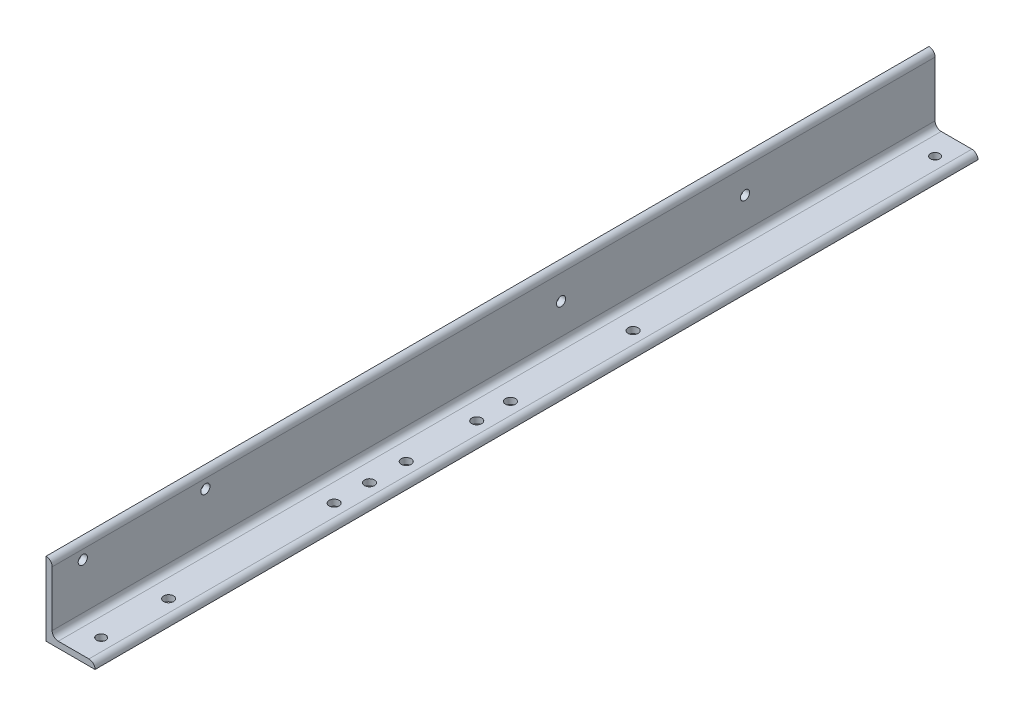
from build123d import *

# Parameters (mm, degrees)
BOSS_EXTRUDE1_DEPTH = 914.4
CUT_EXTRUDE2_REACH  = 932.573
SKETCH3_R           = 9.525
SKETCH3_R_2         = 10.31875
CUT_EXTRUDE3_REACH  = 933.266
SKETCH4_R           = 9.525


with BuildPart() as part:
    # Sketch1 → Boss-Extrude1 (new, symmetric)
    with BuildSketch(Plane.XY):
        with BuildLine():
            Line((0, 0), (0, 152.4))
            Line((0, 152.4), (0.00508, 152.4))
            ThreePointArc((0.00508, 152.4), (8.981744019, 148.681744019), (12.7, 139.70508))
            Line((12.7, 139.70508), (12.7, 25.4))
            ThreePointArc((12.7, 25.4), (16.419743879, 16.419743879), (25.4, 12.7))
            Line((25.4, 12.7), (88.90508, 12.7))
            ThreePointArc((88.90508, 12.7), (97.881744019, 8.981744019), (101.6, 0.00508))
            Line((101.6, 0.00508), (101.6, 0))
            Line((101.6, 0), (0, 0))
        make_face()
    extrude(amount=BOSS_EXTRUDE1_DEPTH, both=True)

    # Sketch3 → Cut-Extrude2 (cut, up to next)
    with BuildSketch(Plane(origin=(0, 12.7, 0), x_dir=(1, 0, 0), z_dir=(0, 1, 0)), mode=Mode.PRIVATE) as cut_extrude2_sk1:
        with Locations((63.5, -863.6)):
            Circle(SKETCH3_R)
    cut_extrude2_tool1 = extrude(cut_extrude2_sk1.sketch, amount=-CUT_EXTRUDE2_REACH, mode=Mode.PRIVATE) & part.part
    # Sketch3 → Cut-Extrude2 (cut, up to next)
    with BuildSketch(Plane(origin=(0, 12.7, 0), x_dir=(1, 0, 0), z_dir=(0, 1, 0)), mode=Mode.PRIVATE) as cut_extrude2_sk2:
        with Locations((63.5, 863.6)):
            Circle(SKETCH3_R)
    cut_extrude2_tool2 = extrude(cut_extrude2_sk2.sketch, amount=-CUT_EXTRUDE2_REACH, mode=Mode.PRIVATE) & part.part
    # Sketch3 → Cut-Extrude2 (cut, up to next)
    with BuildSketch(Plane(origin=(0, 12.7, 0), x_dir=(1, 0, 0), z_dir=(0, 1, 0)), mode=Mode.PRIVATE) as cut_extrude2_sk3:
        with Locations((63.5, -723.9)):
            Circle(SKETCH3_R_2)
    cut_extrude2_tool3 = extrude(cut_extrude2_sk3.sketch, amount=-CUT_EXTRUDE2_REACH, mode=Mode.PRIVATE) & part.part
    # Sketch3 → Cut-Extrude2 (cut, up to next)
    with BuildSketch(Plane(origin=(0, 12.7, 0), x_dir=(1, 0, 0), z_dir=(0, 1, 0)), mode=Mode.PRIVATE) as cut_extrude2_sk4:
        with Locations((63.5, -381)):
            Circle(SKETCH3_R_2)
    cut_extrude2_tool4 = extrude(cut_extrude2_sk4.sketch, amount=-CUT_EXTRUDE2_REACH, mode=Mode.PRIVATE) & part.part
    # Sketch3 → Cut-Extrude2 (cut, up to next)
    with BuildSketch(Plane(origin=(0, 12.7, 0), x_dir=(1, 0, 0), z_dir=(0, 1, 0)), mode=Mode.PRIVATE) as cut_extrude2_sk5:
        with Locations((63.5, -15.875)):
            Circle(SKETCH3_R_2)
    cut_extrude2_tool5 = extrude(cut_extrude2_sk5.sketch, amount=-CUT_EXTRUDE2_REACH, mode=Mode.PRIVATE) & part.part
    # Sketch3 → Cut-Extrude2 (cut, up to next)
    with BuildSketch(Plane(origin=(0, 12.7, 0), x_dir=(1, 0, 0), z_dir=(0, 1, 0)), mode=Mode.PRIVATE) as cut_extrude2_sk6:
        with Locations((63.5, -231.775)):
            Circle(SKETCH3_R_2)
    cut_extrude2_tool6 = extrude(cut_extrude2_sk6.sketch, amount=-CUT_EXTRUDE2_REACH, mode=Mode.PRIVATE) & part.part
    # Sketch3 → Cut-Extrude2 (cut, up to next)
    with BuildSketch(Plane(origin=(0, 12.7, 0), x_dir=(1, 0, 0), z_dir=(0, 1, 0)), mode=Mode.PRIVATE) as cut_extrude2_sk7:
        with Locations((63.5, 238.125)):
            Circle(SKETCH3_R_2)
    cut_extrude2_tool7 = extrude(cut_extrude2_sk7.sketch, amount=-CUT_EXTRUDE2_REACH, mode=Mode.PRIVATE) & part.part
    # Sketch3 → Cut-Extrude2 (cut, up to next)
    with BuildSketch(Plane(origin=(0, 12.7, 0), x_dir=(1, 0, 0), z_dir=(0, 1, 0)), mode=Mode.PRIVATE) as cut_extrude2_sk8:
        with Locations((63.5, -307.975)):
            Circle(SKETCH3_R_2)
    cut_extrude2_tool8 = extrude(cut_extrude2_sk8.sketch, amount=-CUT_EXTRUDE2_REACH, mode=Mode.PRIVATE) & part.part
    # Sketch3 → Cut-Extrude2 (cut, up to next)
    with BuildSketch(Plane(origin=(0, 12.7, 0), x_dir=(1, 0, 0), z_dir=(0, 1, 0)), mode=Mode.PRIVATE) as cut_extrude2_sk9:
        with Locations((63.5, -85.725)):
            Circle(SKETCH3_R_2)
    cut_extrude2_tool9 = extrude(cut_extrude2_sk9.sketch, amount=-CUT_EXTRUDE2_REACH, mode=Mode.PRIVATE) & part.part
    add(cut_extrude2_tool1.solids().sort_by_distance((63.5, 12.7, 863.6))[0], mode=Mode.SUBTRACT)
    add(cut_extrude2_tool2.solids().sort_by_distance((63.5, 12.7, -863.6))[0], mode=Mode.SUBTRACT)
    add(cut_extrude2_tool3.solids().sort_by_distance((63.5, 12.7, 723.9))[0], mode=Mode.SUBTRACT)
    add(cut_extrude2_tool4.solids().sort_by_distance((63.5, 12.7, 381))[0], mode=Mode.SUBTRACT)
    add(cut_extrude2_tool5.solids().sort_by_distance((63.5, 12.7, 15.875))[0], mode=Mode.SUBTRACT)
    add(cut_extrude2_tool6.solids().sort_by_distance((63.5, 12.7, 231.775))[0], mode=Mode.SUBTRACT)
    add(cut_extrude2_tool7.solids().sort_by_distance((63.5, 12.7, -238.125))[0], mode=Mode.SUBTRACT)
    add(cut_extrude2_tool8.solids().sort_by_distance((63.5, 12.7, 307.975))[0], mode=Mode.SUBTRACT)
    add(cut_extrude2_tool9.solids().sort_by_distance((63.5, 12.7, 85.725))[0], mode=Mode.SUBTRACT)

    # Sketch4 → Cut-Extrude3 (cut, up to next)
    with BuildSketch(Plane(origin=(12.7, 0, 0), x_dir=(0, 0, -1), z_dir=(1, 0, 0)), mode=Mode.PRIVATE) as cut_extrude3_sk1:
        with Locations((-850.9, 120.65)):
            Circle(SKETCH4_R)
    cut_extrude3_tool1 = extrude(cut_extrude3_sk1.sketch, amount=-CUT_EXTRUDE3_REACH, mode=Mode.PRIVATE) & part.part
    # Sketch4 → Cut-Extrude3 (cut, up to next)
    with BuildSketch(Plane(origin=(12.7, 0, 0), x_dir=(0, 0, -1), z_dir=(1, 0, 0)), mode=Mode.PRIVATE) as cut_extrude3_sk2:
        with Locations((-596.9, 120.65)):
            Circle(SKETCH4_R)
    cut_extrude3_tool2 = extrude(cut_extrude3_sk2.sketch, amount=-CUT_EXTRUDE3_REACH, mode=Mode.PRIVATE) & part.part
    # Sketch4 → Cut-Extrude3 (cut, up to next)
    with BuildSketch(Plane(origin=(12.7, 0, 0), x_dir=(0, 0, -1), z_dir=(1, 0, 0)), mode=Mode.PRIVATE) as cut_extrude3_sk3:
        with Locations((139.7, 88.9)):
            Circle(SKETCH4_R)
    cut_extrude3_tool3 = extrude(cut_extrude3_sk3.sketch, amount=-CUT_EXTRUDE3_REACH, mode=Mode.PRIVATE) & part.part
    # Sketch4 → Cut-Extrude3 (cut, up to next)
    with BuildSketch(Plane(origin=(12.7, 0, 0), x_dir=(0, 0, -1), z_dir=(1, 0, 0)), mode=Mode.PRIVATE) as cut_extrude3_sk4:
        with Locations((520.7, 88.9)):
            Circle(SKETCH4_R)
    cut_extrude3_tool4 = extrude(cut_extrude3_sk4.sketch, amount=-CUT_EXTRUDE3_REACH, mode=Mode.PRIVATE) & part.part
    add(cut_extrude3_tool1.solids().sort_by_distance((12.7, 120.65, 850.9))[0], mode=Mode.SUBTRACT)
    add(cut_extrude3_tool2.solids().sort_by_distance((12.7, 120.65, 596.9))[0], mode=Mode.SUBTRACT)
    add(cut_extrude3_tool3.solids().sort_by_distance((12.7, 88.9, -139.7))[0], mode=Mode.SUBTRACT)
    add(cut_extrude3_tool4.solids().sort_by_distance((12.7, 88.9, -520.7))[0], mode=Mode.SUBTRACT)


solid = part.part
